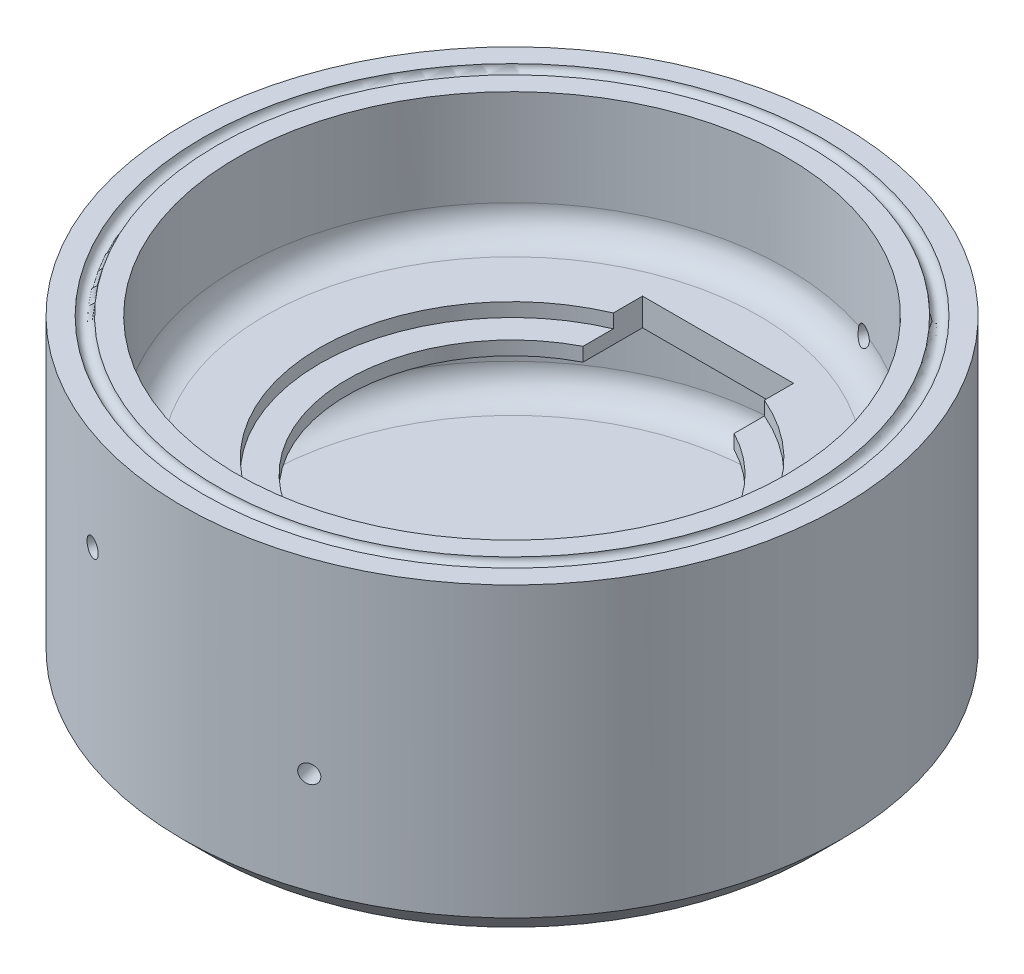
from build123d import *

# Parameters (mm, degrees)
CROQUIS2_R                           = 100
CROQUIS2_R_2                         = 60
SALIENTE_EXTRUIR1_DEPTH              = 10
CORTAR_EXTRUIR1_START                = -5
CROQUIS3_R                           = 70
CROQUIS3_R_2                         = 60
CORTAR_EXTRUIR1_DEPTH                = 5
CROQUIS4_W                           = 55
CROQUIS4_H                           = 150
CORTAR_EXTRUIR3_DEPTH                = 10
REDONDEO1_R                          = 10
CHAFL_N1_SIZE                        = 10
CROQUIS6_R                           = 2.5
TALADRO_DE_MARGEN_PARA_M65_D         = 6.6
TALADRO_DE_MARGEN_PARA_M65_DEPTH     = 40
TALADRO_DE_MARGEN_PARA_M65_TIP       = 1.982840043
TALADRO_DE_MARGEN_PARA_M66_D         = 6.6
TALADRO_DE_MARGEN_PARA_M66_DEPTH     = 40
TALADRO_DE_MARGEN_PARA_M66_TIP       = 1.982840043
TALADRO_START                        = 98
TALADRO_DE_MARGEN_PARA_M67_OUTLINE_R = 3.3
TALADRO_DE_MARGEN_PARA_M67_DEPTH     = 23
TALADRO_START_2                      = -121
TALADRO_DE_MARGEN_PARA_M68_OUTLINE_R = 3.3
TALADRO_DE_MARGEN_PARA_M68_DEPTH     = 23


with BuildPart() as part:
    # Croquis1 → Revolución1 (revolve)
    with BuildSketch(Plane.XY, mode=Mode.PRIVATE) as revoluci_n1_sk:
        Polygon((0, 0), (-120, 0), (-120, 115), (-100, 115), (-100, 20), (0, 20), align=None)
    revolve(revoluci_n1_sk.sketch.rotate(Axis((0, 0, 0), (0, 1, 0)), 180), axis=Axis((0, 0, 0), (0, 1, 0)))

    # Croquis2 → Saliente-Extruir1 (add)
    with BuildSketch(Plane(origin=(0, 60, 0), x_dir=(1, 0, 0), z_dir=(0, 1, 0))):
        Circle(CROQUIS2_R)
        with Locations(Location((0, 0, 0), (0, 0, 180))):
            Circle(CROQUIS2_R_2, mode=Mode.SUBTRACT)
    extrude(amount=SALIENTE_EXTRUIR1_DEPTH)

    # Croquis3 → Cortar-Extruir1 (cut)
    with BuildSketch(Plane(origin=(0, 70, 0), x_dir=(1, 0, 0), z_dir=(0, 1, 0)).offset(CORTAR_EXTRUIR1_START)):
        with Locations(Location((0, 0, 0), (0, 0, 180))):
            Circle(CROQUIS3_R)
        with Locations(Location((0, 0, 0), (0, 0, 180))):
            Circle(CROQUIS3_R_2, mode=Mode.SUBTRACT)
    extrude(amount=CORTAR_EXTRUIR1_DEPTH, mode=Mode.SUBTRACT)

    # Croquis4 → Cortar-Extruir3 (cut)
    with BuildSketch(Plane(origin=(0, 60, 0), x_dir=(1, 0, 0), z_dir=(0, 1, 0))):
        Rectangle(CROQUIS4_W, CROQUIS4_H)
    extrude(amount=CORTAR_EXTRUIR3_DEPTH, mode=Mode.SUBTRACT)

    # Redondeo1
    redondeo1_edges = [part.edges().sort_by_distance(p)[0] for p in [
        (-100, 60, 0),
        (-100, 70, 0),
        (-100, 20, 0),
    ]]
    fillet(redondeo1_edges, radius=REDONDEO1_R)

    # Chaflán1
    chafl_n1_edges = [part.edges().sort_by_distance(p)[0] for p in [
        (-120, 0, 0),
    ]]
    chamfer(chafl_n1_edges, length=CHAFL_N1_SIZE)

    # Cortar-Barrer1: sweep along a path in Croquis5
    with BuildLine(Plane(origin=(0, 115, 0), x_dir=(1, 0, 0), z_dir=(0, 1, 0))) as cortar_barrer1_path:
        CenterArc((0, 0), 110, 0, 360)
    # Croquis6 → Cortar-Barrer1 (sweep, cut)
    with BuildSketch(Plane.XY):
        with Locations((-110, 115)):
            Circle(CROQUIS6_R)
    sweep(path=cortar_barrer1_path.line, mode=Mode.SUBTRACT)

    # Taladro de margen para M65
    with Locations(Plane(origin=(33.775885386, 0, -126.053320331), x_dir=(0, -1, 0), z_dir=(0.2588190451025245, 0, -0.9659258262890673))):
        with Locations((-79, -8.775885386)):
            Hole(TALADRO_DE_MARGEN_PARA_M65_D / 2, depth=TALADRO_DE_MARGEN_PARA_M65_DEPTH)
            with Locations((0, 0, -(TALADRO_DE_MARGEN_PARA_M65_DEPTH + TALADRO_DE_MARGEN_PARA_M65_TIP / 2))):  # 118° drill point
                Cone(0, TALADRO_DE_MARGEN_PARA_M65_D / 2, TALADRO_DE_MARGEN_PARA_M65_TIP, mode=Mode.SUBTRACT)

    # Taladro de margen para M66
    with Locations(Plane(origin=(-33.775885386, 0, -126.053320331), x_dir=(0, -1, 0), z_dir=(-0.25881904510252496, 0, -0.9659258262890672))):
        with Locations((-47, 8.775885386)):
            Hole(TALADRO_DE_MARGEN_PARA_M66_D / 2, depth=TALADRO_DE_MARGEN_PARA_M66_DEPTH)
            with Locations((0, 0, -(TALADRO_DE_MARGEN_PARA_M66_DEPTH + TALADRO_DE_MARGEN_PARA_M66_TIP / 2))):  # 118° drill point
                Cone(0, TALADRO_DE_MARGEN_PARA_M66_D / 2, TALADRO_DE_MARGEN_PARA_M66_TIP, mode=Mode.SUBTRACT)

    # Taladro de margen para M67: read off the stored shape, not the designer's step
    # Taladro de margen para M67 outline → Taladro de margen para M67 (cut)
    with BuildSketch(Plane(origin=(0, 0, 0), x_dir=(0.9659258262890652, 0, -0.2588190451025322), z_dir=(0.2588190451025321, 0, 0.9659258262890653)).offset(TALADRO_START)):
        with Locations((8.775885386, 47)):
            Circle(TALADRO_DE_MARGEN_PARA_M67_OUTLINE_R)
    extrude(amount=TALADRO_DE_MARGEN_PARA_M67_DEPTH, mode=Mode.SUBTRACT)

    # Taladro de margen para M68: read off the stored shape, not the designer's step
    # Taladro de margen para M68 outline → Taladro de margen para M68 (cut)
    with BuildSketch(Plane(origin=(0, 0, 0), x_dir=(0.9659258262890691, 0, 0.25881904510251813), z_dir=(0.2588190451025181, 0, -0.9659258262890691)).offset(TALADRO_START_2)):
        with Locations((-8.775885386, -79)):
            Circle(TALADRO_DE_MARGEN_PARA_M68_OUTLINE_R)
    extrude(amount=TALADRO_DE_MARGEN_PARA_M68_DEPTH, mode=Mode.SUBTRACT)


solid = part.part
